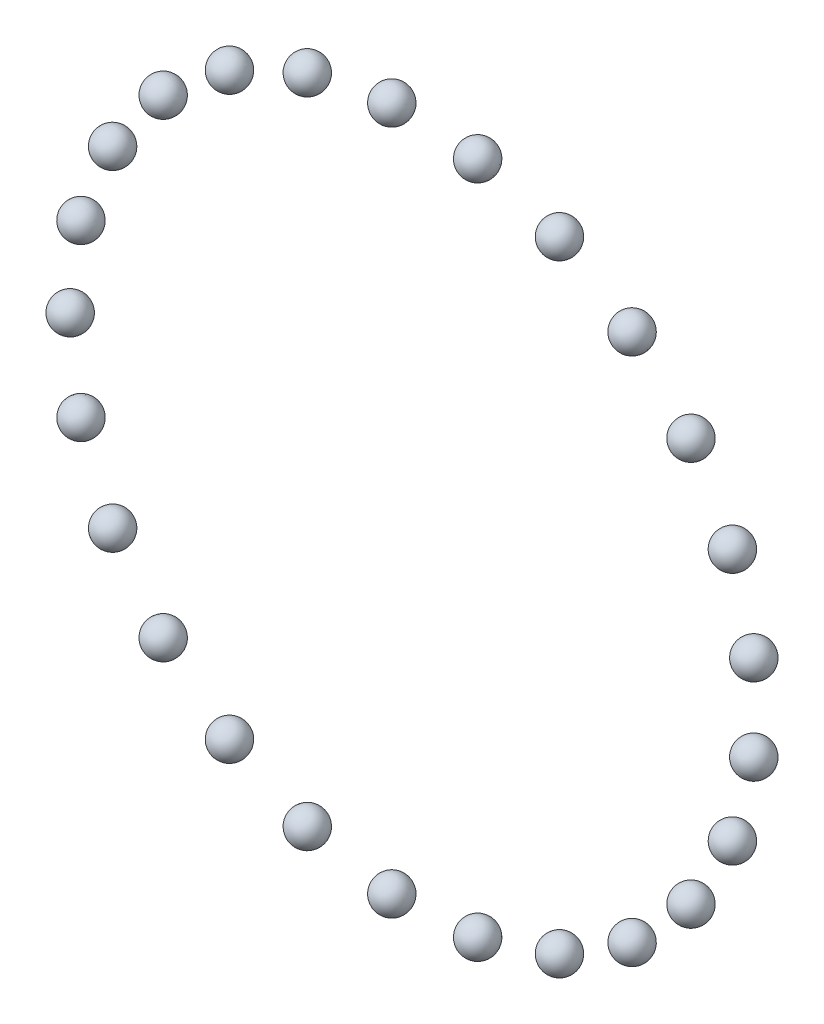
from build123d import *

# Parameters (mm, degrees)
CIRPATTERN1_COUNT = 25


with BuildPart() as part:
    # Sketch1 → Revolve1 (revolve)
    with BuildSketch(Plane.XY):
        with BuildLine():
            ThreePointArc((-76, 0), (-80, 4), (-84, 0))
            Line((-84, 0), (-76, 0))
        make_face()
    revolve(axis=Axis((-84, 0, 0), (1, 0, 0)))


with BuildPart() as cirpattern1_1:
    # CirPattern1: pattern copy
    add(part.part.rotate(Axis((0, 0, 4.4), (0, 0, -1)), 1 * 360 / CIRPATTERN1_COUNT))


with BuildPart() as cirpattern1_2:
    # CirPattern1: pattern copy
    add(part.part.rotate(Axis((0, 0, 4.4), (0, 0, -1)), 2 * 360 / CIRPATTERN1_COUNT))


with BuildPart() as cirpattern1_3:
    # CirPattern1: pattern copy
    add(part.part.rotate(Axis((0, 0, 4.4), (0, 0, -1)), 3 * 360 / CIRPATTERN1_COUNT))


with BuildPart() as cirpattern1_4:
    # CirPattern1: pattern copy
    add(part.part.rotate(Axis((0, 0, 4.4), (0, 0, -1)), 4 * 360 / CIRPATTERN1_COUNT))


with BuildPart() as cirpattern1_5:
    # CirPattern1: pattern copy
    add(part.part.rotate(Axis((0, 0, 4.4), (0, 0, -1)), 5 * 360 / CIRPATTERN1_COUNT))


with BuildPart() as cirpattern1_6:
    # CirPattern1: pattern copy
    add(part.part.rotate(Axis((0, 0, 4.4), (0, 0, -1)), 6 * 360 / CIRPATTERN1_COUNT))


with BuildPart() as cirpattern1_7:
    # CirPattern1: pattern copy
    add(part.part.rotate(Axis((0, 0, 4.4), (0, 0, -1)), 7 * 360 / CIRPATTERN1_COUNT))


with BuildPart() as cirpattern1_8:
    # CirPattern1: pattern copy
    add(part.part.rotate(Axis((0, 0, 4.4), (0, 0, -1)), 8 * 360 / CIRPATTERN1_COUNT))


with BuildPart() as cirpattern1_9:
    # CirPattern1: pattern copy
    add(part.part.rotate(Axis((0, 0, 4.4), (0, 0, -1)), 9 * 360 / CIRPATTERN1_COUNT))


with BuildPart() as cirpattern1_10:
    # CirPattern1: pattern copy
    add(part.part.rotate(Axis((0, 0, 4.4), (0, 0, -1)), 10 * 360 / CIRPATTERN1_COUNT))


with BuildPart() as cirpattern1_11:
    # CirPattern1: pattern copy
    add(part.part.rotate(Axis((0, 0, 4.4), (0, 0, -1)), 11 * 360 / CIRPATTERN1_COUNT))


with BuildPart() as cirpattern1_12:
    # CirPattern1: pattern copy
    add(part.part.rotate(Axis((0, 0, 4.4), (0, 0, -1)), 12 * 360 / CIRPATTERN1_COUNT))


with BuildPart() as cirpattern1_13:
    # CirPattern1: pattern copy
    add(part.part.rotate(Axis((0, 0, 4.4), (0, 0, -1)), 13 * 360 / CIRPATTERN1_COUNT))


with BuildPart() as cirpattern1_14:
    # CirPattern1: pattern copy
    add(part.part.rotate(Axis((0, 0, 4.4), (0, 0, -1)), 14 * 360 / CIRPATTERN1_COUNT))


with BuildPart() as cirpattern1_15:
    # CirPattern1: pattern copy
    add(part.part.rotate(Axis((0, 0, 4.4), (0, 0, -1)), 15 * 360 / CIRPATTERN1_COUNT))


with BuildPart() as cirpattern1_16:
    # CirPattern1: pattern copy
    add(part.part.rotate(Axis((0, 0, 4.4), (0, 0, -1)), 16 * 360 / CIRPATTERN1_COUNT))


with BuildPart() as cirpattern1_17:
    # CirPattern1: pattern copy
    add(part.part.rotate(Axis((0, 0, 4.4), (0, 0, -1)), 17 * 360 / CIRPATTERN1_COUNT))


with BuildPart() as cirpattern1_18:
    # CirPattern1: pattern copy
    add(part.part.rotate(Axis((0, 0, 4.4), (0, 0, -1)), 18 * 360 / CIRPATTERN1_COUNT))


with BuildPart() as cirpattern1_19:
    # CirPattern1: pattern copy
    add(part.part.rotate(Axis((0, 0, 4.4), (0, 0, -1)), 19 * 360 / CIRPATTERN1_COUNT))


with BuildPart() as cirpattern1_20:
    # CirPattern1: pattern copy
    add(part.part.rotate(Axis((0, 0, 4.4), (0, 0, -1)), 20 * 360 / CIRPATTERN1_COUNT))


with BuildPart() as cirpattern1_21:
    # CirPattern1: pattern copy
    add(part.part.rotate(Axis((0, 0, 4.4), (0, 0, -1)), 21 * 360 / CIRPATTERN1_COUNT))


with BuildPart() as cirpattern1_22:
    # CirPattern1: pattern copy
    add(part.part.rotate(Axis((0, 0, 4.4), (0, 0, -1)), 22 * 360 / CIRPATTERN1_COUNT))


with BuildPart() as cirpattern1_23:
    # CirPattern1: pattern copy
    add(part.part.rotate(Axis((0, 0, 4.4), (0, 0, -1)), 23 * 360 / CIRPATTERN1_COUNT))


with BuildPart() as cirpattern1_24:
    # CirPattern1: pattern copy
    add(part.part.rotate(Axis((0, 0, 4.4), (0, 0, -1)), 24 * 360 / CIRPATTERN1_COUNT))


solid = Compound([part.part, cirpattern1_1.part, cirpattern1_2.part, cirpattern1_3.part, cirpattern1_4.part, cirpattern1_5.part, cirpattern1_6.part, cirpattern1_7.part, cirpattern1_8.part, cirpattern1_9.part, cirpattern1_10.part, cirpattern1_11.part, cirpattern1_12.part, cirpattern1_13.part, cirpattern1_14.part, cirpattern1_15.part, cirpattern1_16.part, cirpattern1_17.part, cirpattern1_18.part, cirpattern1_19.part, cirpattern1_20.part, cirpattern1_21.part, cirpattern1_22.part, cirpattern1_23.part, cirpattern1_24.part])
